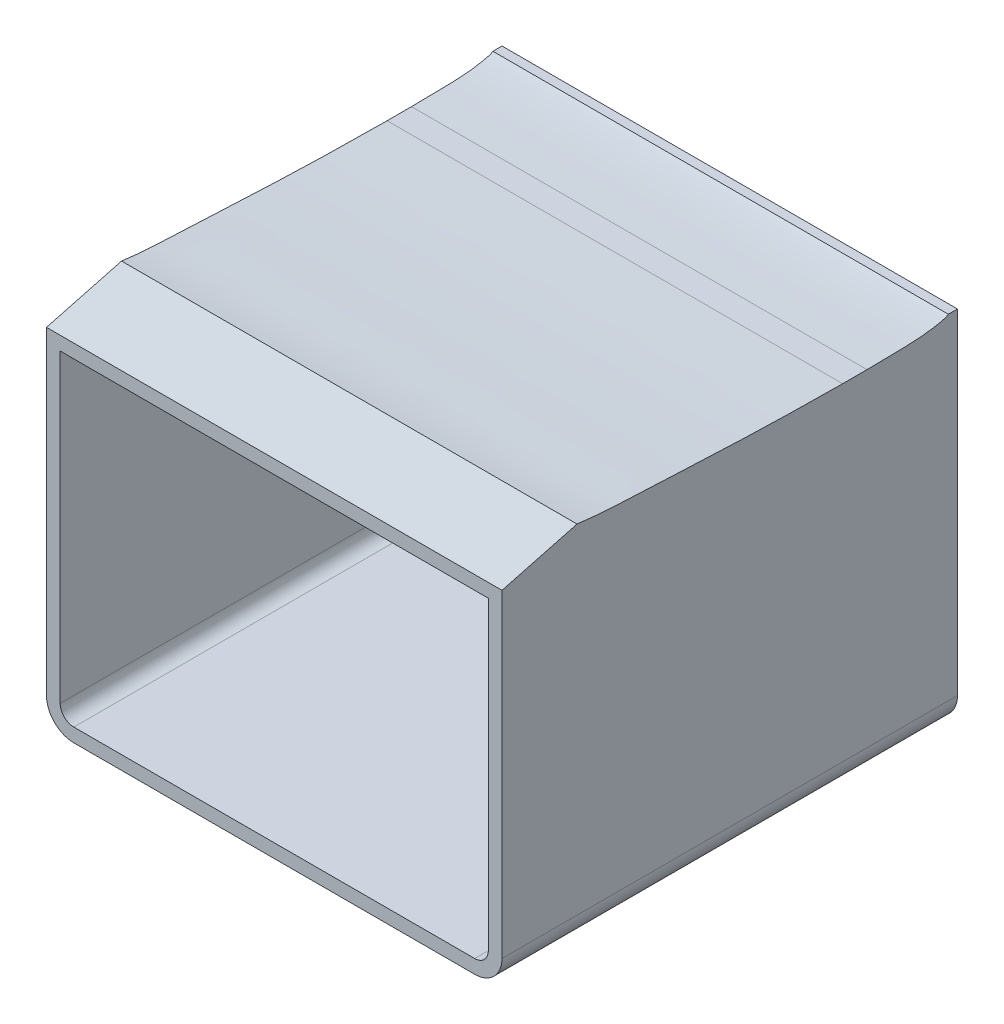
from build123d import *

# Parameters (mm, degrees)
BOSS_EXTRUDE1_DEPTH = 50
SHELL1_T            = -3
BOSS_EXTRUDE2_DEPTH = 50


with BuildPart() as part:
    # Sketch1 → Boss-Extrude1 (new, symmetric)
    with BuildSketch(Plane.XY):
        with BuildLine():
            Line((-44, -41), (44, -41))
            ThreePointArc((44, -41), (48.242640687, -39.242640687), (50, -35))
            Line((50, -35), (50, 35))
            Line((50, 35), (-50, 35))
            Line((-50, 35), (-50, -35))
            ThreePointArc((-50, -35), (-48.242640687, -39.242640687), (-44, -41))
        make_face()
    extrude(amount=BOSS_EXTRUDE1_DEPTH, both=True)

    # Shell1
    shell1_openings = [part.faces().sort_by_distance(p)[0] for p in [
        (0, -2.925316237, 50),
        (0, -2.925316237, -50),
    ]]
    offset(amount=SHELL1_T, openings=shell1_openings, kind=Kind.INTERSECTION)

    # Sketch2 → Boss-Extrude2 (add, symmetric)
    with BuildSketch(Plane(origin=(0, 0, 0), x_dir=(0, 0, -1), z_dir=(1, 0, 0))):
        with BuildLine():
            Line((24.789056739, 36.888494508), (30.129008801, 36.90035309))
            add(Edge.make_bspline(
                [(48, 38.492145588), (47.845230652, 38.382436673), (47.678329902, 38.289516998), (47.334968488, 38.136487141), (47.156039723, 38.079608396), (46.792360746, 37.981622163), (46.608345182, 37.939354802), (46.240915983, 37.855768374), (46.05692279, 37.815544353), (45.135479594, 37.622744854), (44.393305831, 37.496776247), (42.899057321, 37.300606945), (42.148203143, 37.228935241), (40.647781264, 37.120443593), (39.897077648, 37.082995351), (37.644207035, 36.996554303), (36.141215743, 36.975665432), (33.135270832, 36.932603263), (31.632233555, 36.913282197), (30.129008801, 36.90035309)],
                knots=[0, 0, 0, 0, 0.03125, 0.03125, 0.0625, 0.0625, 0.09375, 0.09375, 0.125, 0.125, 0.25, 0.25, 0.375, 0.375, 0.5, 0.5, 0.75, 0.75, 1, 1, 1, 1], degree=3))
            Line((48, 38.492145588), (50, 38.492145588))
            Line((50, 38.492145588), (50, 35))
            Line((50, 35), (-50, 35))
            Line((-50, 35), (-33.525555082, 39.370487806))
            add(Edge.make_bspline(
                [(-33.525555082, 39.370487806), (-31.404446021, 39.097351733), (-29.895342205, 38.954694963), (-28.260719756, 38.800172817), (-26.256470243, 38.684416866), (-24.864349675, 38.604014581), (-22.612028405, 38.50773976), (-21.700603976, 38.468781187), (-20.789160072, 38.430280919), (-20.041666667, 38.398706079), (-18.966567024, 38.348195938), (-17.477343402, 38.278229498), (-15.322384454, 38.167161871), (-13.500497191, 38.07326092), (-11.678645252, 37.978677075), (-8.488223917, 37.813042145), (-4.389044253, 37.63737784), (4.612949024, 37.251610681), (10.196239464, 37.116316819), (12.962923611, 37.049274743), (17.492108513, 36.98140254), (19.971702039, 36.944244535), (21.140393478, 36.927586077), (23.330528672, 36.896368021), (24.789056739, 36.888494508)],
                knots=[0, 0, 0, 0.0625, 0.0625, 0.125, 0.125, 0.1875, 0.1875, 0.21875, 0.21875, 0.25, 0.25, 0.3125, 0.3125, 0.375, 0.375, 0.5, 0.5, 0.75, 0.75, 0.875, 0.875, 0.9375, 0.9375, 1, 1, 1], degree=2))
        make_face()
    extrude(amount=BOSS_EXTRUDE2_DEPTH, both=True)


solid = part.part
